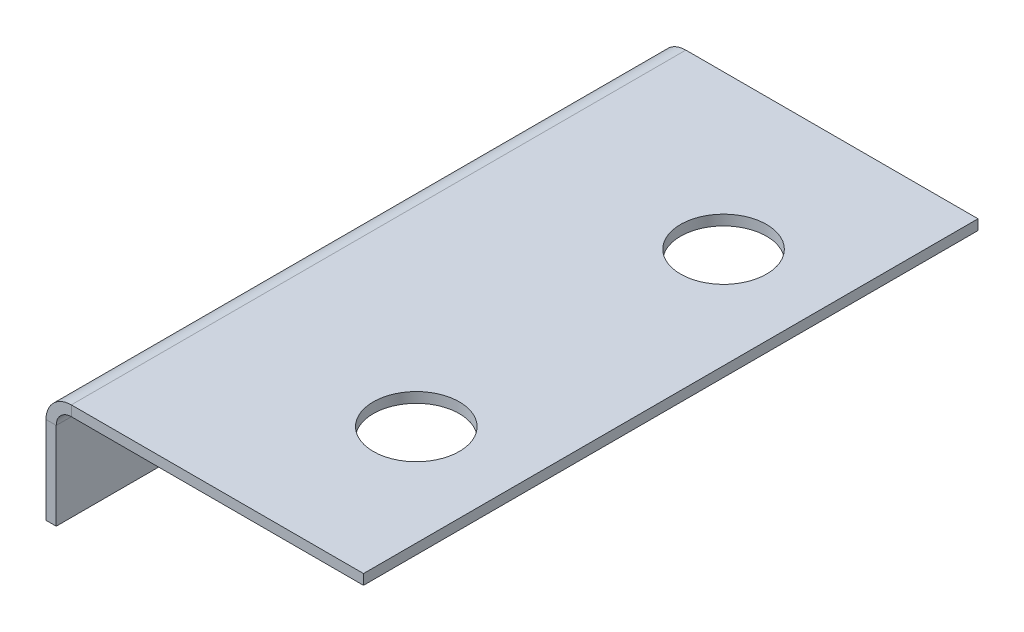
from build123d import *

# Parameters (mm, degrees)
SKETCH1_W                    = 15
SKETCH1_H                    = 30
SKETCH1_R                    = 2.1
BASE_FLANGE1_DEPTH           = 0.5
EDGE_FLANGE1_STRIP_W         = 3.4732
EDGE_FLANGE1_STRIP_H         = 0.5
EDGE_FLANGE1_STRIP_CUT_DEPTH = 30
EDGE_FLANGE1_DEPTH           = 30
SKETCH8_R                    = 1.1
CUT_EXTRUDE1_DEPTH           = 10


# Sheet-metal steps are written as plain solids
with BuildPart() as part:
    # Sketch1 → Base-Flange1 (new body)
    with BuildSketch(Plane(origin=(0, 0, 0), x_dir=(1, 0, 0), z_dir=(0, 1, 0))):
        with Locations((10.481024164, 1.814426404)):
            Rectangle(SKETCH1_W, SKETCH1_H)
        with Locations(Location((13.058795971, -5.685573596, 0), (0, 0, 270))):
            Circle(SKETCH1_R, mode=Mode.SUBTRACT)
        with Locations(Location((13.058795971, 9.314426404, 0), (0, 0, 270))):
            Circle(SKETCH1_R, mode=Mode.SUBTRACT)
    extrude(amount=-BASE_FLANGE1_DEPTH)

    # Edge-Flange1 strip (across the edge) → Edge-Flange1 strip cut (cut)
    with BuildSketch(Plane(origin=(2.981024164, -0.5, 13.185573596), x_dir=(1, 0, 0), z_dir=(0, 0, -1))):
        with Locations((-1, -0.25)):
            Rectangle(EDGE_FLANGE1_STRIP_W, EDGE_FLANGE1_STRIP_H)
    extrude(amount=EDGE_FLANGE1_STRIP_CUT_DEPTH, mode=Mode.SUBTRACT)

    # Edge-Flange1 section (across the edge) → Edge-Flange1 (add)
    with BuildSketch(Plane(origin=(2.981024164, -0.5, 13.185573596), x_dir=(1, 0, 0), z_dir=(0, 0, -1))):
        with BuildLine():
            Line((-0.5, 0.7366), (-0.5, 5))
            Line((-0.5, 5), (0, 5))
            Line((0, 5), (0, 0.7366))
            ThreePointArc((0, 0.7366), (0.215745145, 0.215745145), (0.7366, 0))
            Line((0.7366, 0), (0.7366, -0.5))
            ThreePointArc((0.7366, -0.5), (-0.137808246, -0.137808246), (-0.5, 0.7366))
        make_face()
    extrude(amount=EDGE_FLANGE1_DEPTH)

    # Sketch8 → Cut-Extrude1 (cut)
    with BuildSketch(Plane(origin=(2.981024164, 0, 0), x_dir=(0, 0, -1), z_dir=(1, 0, 0))):
        with Locations(Location((5.114426404, -3.5, 0), (0, 0, 90))):
            Circle(SKETCH8_R)
        with Locations(Location((-1.485573596, -3.5, 0), (0, 0, 90))):
            Circle(SKETCH8_R)
    extrude(amount=-CUT_EXTRUDE1_DEPTH, mode=Mode.SUBTRACT)


solid = part.part
